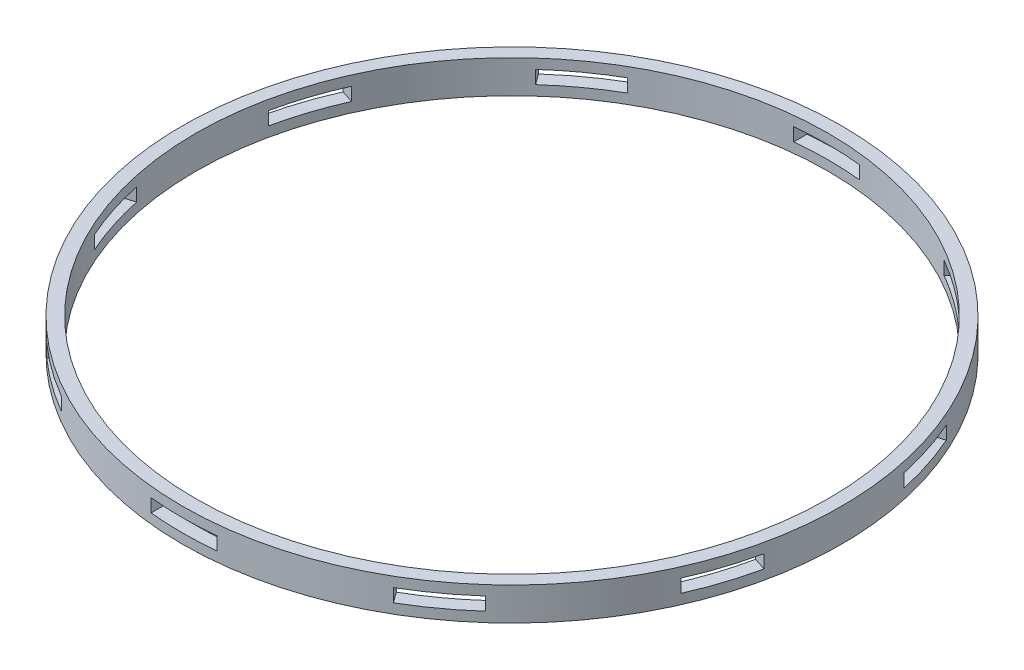
from build123d import *

# Parameters (mm, degrees)
SKETCH1_R           = 100
SKETCH1_R_2         = 96
BOSS_EXTRUDE1_DEPTH = 10
SKETCH2_W           = 20
SKETCH2_H           = 4
CUT_EXTRUDE1_DEPTH  = 142.774468788
CIRPATTERN1_COUNT   = 10


with BuildPart() as part:
    # Sketch1 → Boss-Extrude1 (new body)
    with BuildSketch(Plane(origin=(0, 0, 0), x_dir=(1, 0, 0), z_dir=(0, 1, 0))):
        Circle(SKETCH1_R)
        Circle(SKETCH1_R_2, mode=Mode.SUBTRACT)
    extrude(amount=BOSS_EXTRUDE1_DEPTH)

    # Sketch2 → Cut-Extrude1 (cut, through all)
    with BuildSketch(Plane.XY):
        with Locations((0, 5)):
            Rectangle(SKETCH2_W, SKETCH2_H)
    cut_extrude1 = extrude(amount=-CUT_EXTRUDE1_DEPTH, mode=Mode.SUBTRACT)

    # CirPattern1: Cut-Extrude1 ×10 about axis
    cirpattern1_axis = Axis((0, 10, 0), (0, -1, 0))
    for i in range(1, CIRPATTERN1_COUNT):
        add(cut_extrude1.rotate(cirpattern1_axis, i * 360 / CIRPATTERN1_COUNT), mode=Mode.SUBTRACT)


solid = part.part
